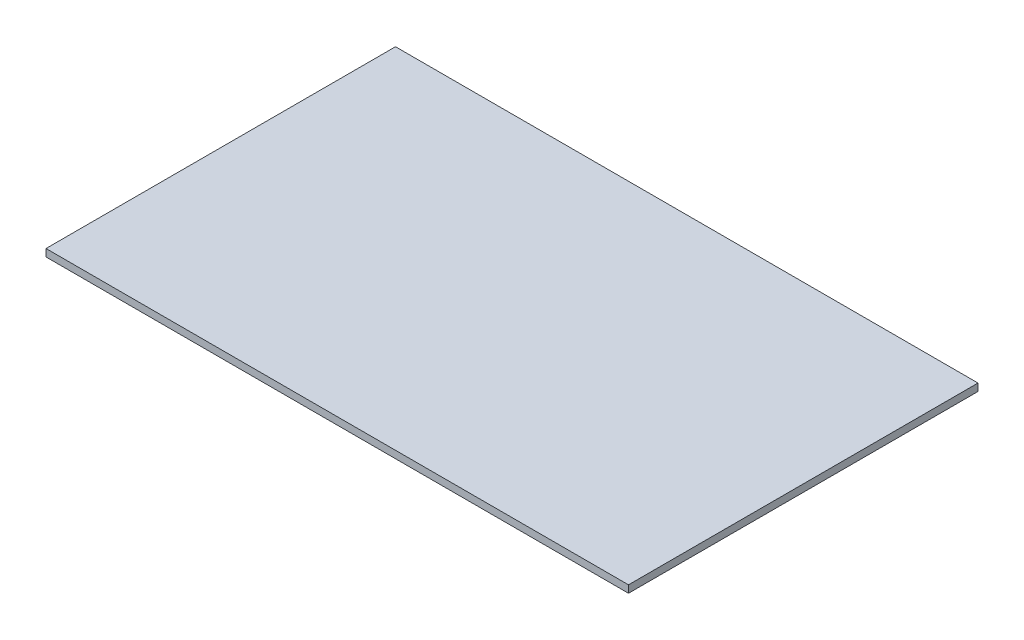
from build123d import *

# Parameters (mm, degrees)
SKETCH1_W           = 127
SKETCH1_H           = 76.2
BOSS_EXTRUDE1_DEPTH = 1.6


with BuildPart() as part:
    # Sketch1 → Boss-Extrude1 (new body)
    with BuildSketch(Plane(origin=(0, 0, 0), x_dir=(1, 0, 0), z_dir=(0, 1, 0))):
        Rectangle(SKETCH1_W, SKETCH1_H)
    extrude(amount=BOSS_EXTRUDE1_DEPTH)


solid = part.part
